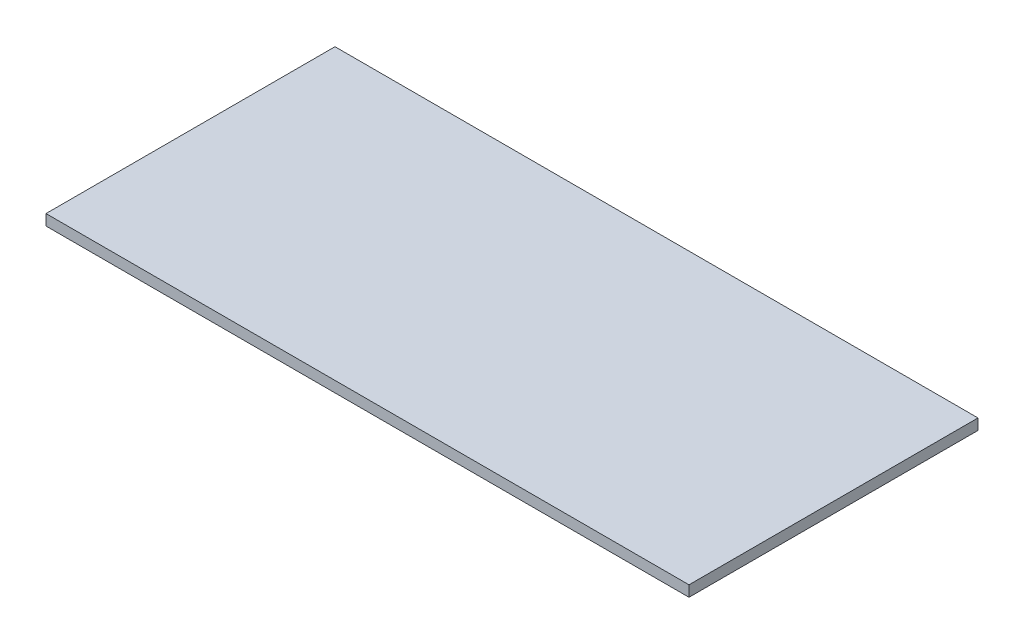
from build123d import *

# Parameters (mm, degrees)
SKETCH1_W           = 89
SKETCH1_H           = 40
BOSS_EXTRUDE1_DEPTH = 1.5


with BuildPart() as part:
    # Sketch1 → Boss-Extrude1 (new body)
    with BuildSketch(Plane(origin=(0, 0, 0), x_dir=(1, 0, 0), z_dir=(0, 1, 0))):
        with Locations((44.5, 20)):
            Rectangle(SKETCH1_W, SKETCH1_H)
    extrude(amount=BOSS_EXTRUDE1_DEPTH)


solid = part.part
